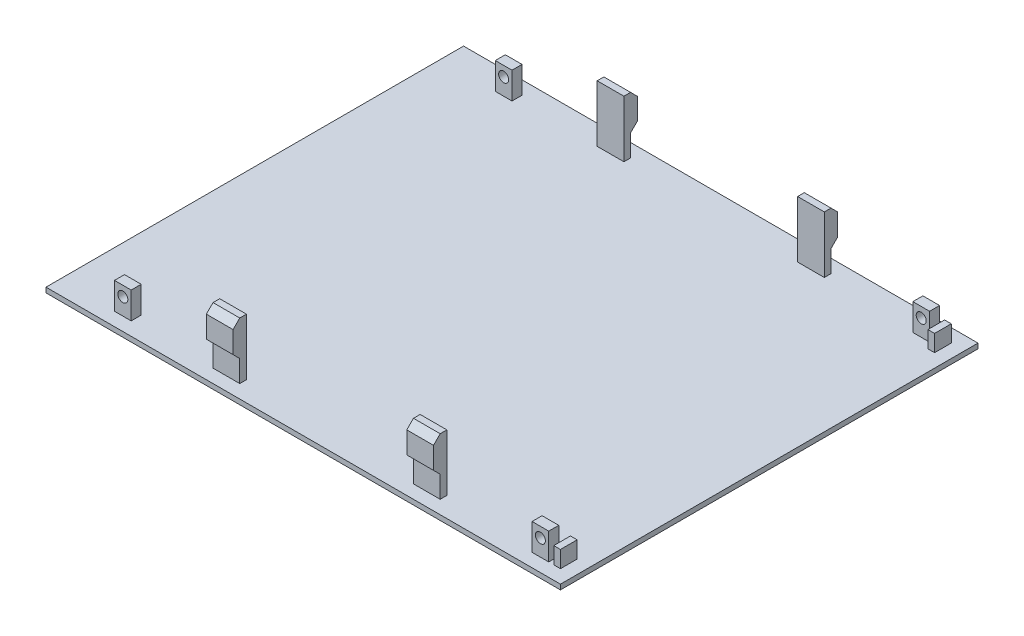
from build123d import *

# Parameters (mm, degrees)
SKETCH1_W                  = 154
SKETCH1_H                  = 125
BOSS_EXTRUDE1_DEPTH        = 1.5
SKETCH2_W                  = 2
SKETCH2_H                  = 5
BOSS_EXTRUDE2_DEPTH        = 5
SKETCH3_W                  = 8
SKETCH3_H                  = 2
BOSS_EXTRUDE3_DEPTH        = 17
SKETCH4_W                  = 2
SKETCH4_H                  = 10.5
BOSS_EXTRUDE4_DEPTH        = 8
CHAMFER1_SIZE              = 2
LPATTERN1_COUNT            = 2
LPATTERN1_PITCH            = 60
CHAMFER1_OF_LPATTERN1_SIZE = 2
SKETCH5_W                  = 5
SKETCH5_H                  = 3
BOSS_EXTRUDE5_DEPTH        = 8
CUT_EXTRUDE1_REACH         = 146.611
SKETCH6_R                  = 1.5
LPATTERN2_COUNT            = 2
LPATTERN2_PITCH            = 125
MIRROR1_START              = -31
MIRROR1_DEPTH              = 8
MIRROR1_START_2            = 29
MIRROR1_2_DEPTH            = 8
MIRROR1_START_3            = 71
MIRROR1_3_OUTLINE_W        = 5
MIRROR1_3_OUTLINE_H        = 5
MIRROR1_3_DEPTH            = 2
MIRROR1_START_4            = 55.5
MIRROR1_4_OUTLINE_W        = 5
MIRROR1_4_OUTLINE_H        = 8
MIRROR1_4_OUTLINE_R        = 1.5
MIRROR1_4_DEPTH            = 3


# Read off the part's stored shape, not the designer's step: Mirror1
with BuildPart() as part:
    # Sketch1 → Boss-Extrude1 (new body)
    with BuildSketch(Plane(origin=(0, 0, 0), x_dir=(1, 0, 0), z_dir=(0, 1, 0))):
        Rectangle(SKETCH1_W, SKETCH1_H)
    extrude(amount=BOSS_EXTRUDE1_DEPTH)

    # Sketch2 → Boss-Extrude2 (add)
    with BuildSketch(Plane(origin=(0, 1.5, 0), x_dir=(1, 0, 0), z_dir=(0, 1, 0))):
        with Locations((72, 56)):
            Rectangle(SKETCH2_W, SKETCH2_H)
    extrude(amount=BOSS_EXTRUDE2_DEPTH)

    # Sketch3 → Boss-Extrude3 (add)
    with BuildSketch(Plane(origin=(0, 1.5, 0), x_dir=(1, 0, 0), z_dir=(0, 1, 0))):
        with Locations((-27, 57.5)):
            Rectangle(SKETCH3_W, SKETCH3_H)
    boss_extrude3 = extrude(amount=BOSS_EXTRUDE3_DEPTH)

    # Sketch4 → Boss-Extrude4 (add)
    with BuildSketch(Plane.ZY.offset(31)):
        with Locations((-59.5, 13.25)):
            Rectangle(SKETCH4_W, SKETCH4_H)
    boss_extrude4 = extrude(amount=-BOSS_EXTRUDE4_DEPTH)

    # Chamfer1
    chamfer1_edges = [part.edges().sort_by_distance(p)[0] for p in [
        (-27, 18.5, -60.5),
        (-27, 8, -60.5),
    ]]
    chamfer(chamfer1_edges, length=CHAMFER1_SIZE - 0.0001)  # a hair under: the kernel refuses the full size

    # LPattern1: Boss-Extrude3, Boss-Extrude4 ×2
    with Locations(*[(i * LPATTERN1_PITCH, 0, 0) for i in range(1, LPATTERN1_COUNT)]):
        add(boss_extrude3)
        add(boss_extrude4)

    # Chamfer1 of LPattern1
    chamfer1_of_lpattern1_edges = [part.edges().sort_by_distance(p)[0] for p in [
        (33, 18.5, -60.5),
        (33, 8, -60.5),
    ]]
    chamfer(chamfer1_of_lpattern1_edges, length=CHAMFER1_OF_LPATTERN1_SIZE - 0.0001)  # a hair under: the kernel refuses the full size

    # Sketch5 → Boss-Extrude5 (add)
    with BuildSketch(Plane(origin=(0, 1.5, 0), x_dir=(1, 0, 0), z_dir=(0, 1, 0))):
        with Locations((67, 57)):
            Rectangle(SKETCH5_W, SKETCH5_H)
    boss_extrude5 = extrude(amount=BOSS_EXTRUDE5_DEPTH)

    # Sketch6 → Cut-Extrude1 (cut, up to next)
    with BuildSketch(Plane(origin=(0, 0, -58.5), x_dir=(-1, 0, 0), z_dir=(0, 0, -1)), mode=Mode.PRIVATE) as cut_extrude1_sk1:
        with Locations((-67, 6.5)):
            Circle(SKETCH6_R)
    cut_extrude1_tool1 = extrude(cut_extrude1_sk1.sketch, amount=-CUT_EXTRUDE1_REACH, mode=Mode.PRIVATE) & part.part
    cut_extrude1 = cut_extrude1_tool1.solids().sort_by_distance((67, 6.5, -58.5))[0]
    add(cut_extrude1, mode=Mode.SUBTRACT)

    # LPattern2: Boss-Extrude5, Cut-Extrude1 ×2
    with Locations(*[(-i * LPATTERN2_PITCH, 0, 0) for i in range(1, LPATTERN2_COUNT)]):
        add(boss_extrude5)
        add(cut_extrude1, mode=Mode.SUBTRACT)

    # Mirror1 outline → Mirror1 (add)
    with BuildSketch(Plane.YZ.offset(MIRROR1_START)):
        Polygon((10, 60.5), (8, 58.5), (1.5, 58.5), (1.5, 56.5), (18.5, 56.5), (18.5, 58.5), (16.5, 60.5), align=None)
    extrude(amount=MIRROR1_DEPTH)

    # Mirror1 2 outline → Mirror1 2 (add)
    with BuildSketch(Plane.YZ.offset(MIRROR1_START_2)):
        Polygon((10, 60.5), (8, 58.5), (1.5, 58.5), (1.5, 56.5), (18.5, 56.5), (18.5, 58.5), (16.5, 60.5), align=None)
    extrude(amount=MIRROR1_2_DEPTH)

    # Mirror1 3 outline → Mirror1 3 (add)
    with BuildSketch(Plane.YZ.offset(MIRROR1_START_3)):
        with Locations((4, 56)):
            Rectangle(MIRROR1_3_OUTLINE_W, MIRROR1_3_OUTLINE_H)
    extrude(amount=MIRROR1_3_DEPTH)

    # Mirror1 4 outline → Mirror1 4 (add)
    # profile 1 of 2: a face of its own
    with BuildSketch(Plane.XY.offset(MIRROR1_START_4)):
        with Locations((67, 5.5)):
            Rectangle(MIRROR1_4_OUTLINE_W, MIRROR1_4_OUTLINE_H)
        with Locations((67, 6.5)):
            Circle(MIRROR1_4_OUTLINE_R, mode=Mode.SUBTRACT)
    # profile 2 of 2: a face of its own
    with BuildSketch(Plane.XY.offset(MIRROR1_START_4)):
        with Locations((-58, 5.5)):
            Rectangle(MIRROR1_4_OUTLINE_W, MIRROR1_4_OUTLINE_H)
        with Locations((-58, 6.5)):
            Circle(MIRROR1_4_OUTLINE_R, mode=Mode.SUBTRACT)
    extrude(amount=MIRROR1_4_DEPTH)


solid = part.part
